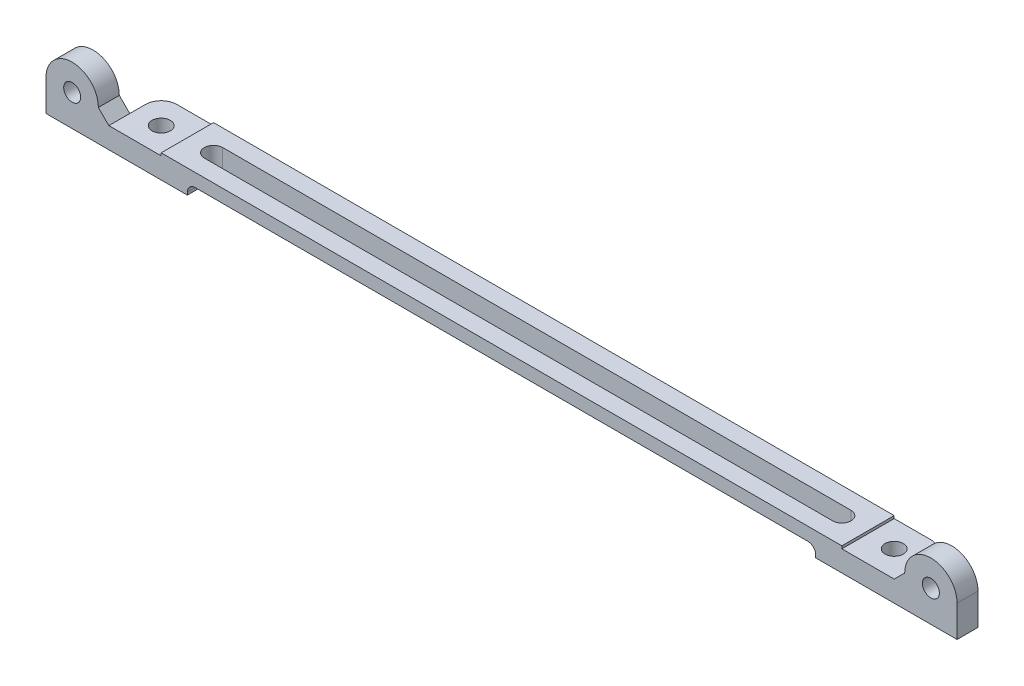
from build123d import *

# Parameters (mm, degrees)
SKETCH1_R           = 1.75
BOSS_EXTRUDE1_DEPTH = 4
SKETCH2_W           = 130
SKETCH2_H           = 10
BOSS_EXTRUDE2_DEPTH = 0.5
CUT_EXTRUDE1_DEPTH  = 2
SKETCH4_R           = 1.624205192
BOSS_EXTRUDE3_DEPTH = 4


with BuildPart() as part:
    # Sketch1 → Boss-Extrude1 (new body)
    with BuildSketch(Plane(origin=(0, 0, 0), x_dir=(1, 0, 0), z_dir=(0, 1, 0))):
        with BuildLine():
            ThreePointArc((75, 2), (74.121320344, 4.121320344), (72, 5))
            Line((72, 5), (-72, 5))
            ThreePointArc((-72, 5), (-74.121320344, 4.121320344), (-75, 2))
            Line((-75, 2), (-75, -5))
            Line((-75, -5), (75, -5))
            Line((75, -5), (75, 2))
        make_face()
        with Locations((-70, 0)):
            Circle(SKETCH1_R, mode=Mode.SUBTRACT)
        with BuildLine():
            ThreePointArc((61.75, 0), (61.237436867, -1.237436867), (60, -1.75))
            Line((60, -1.75), (-60, -1.75))
            ThreePointArc((-60, -1.75), (-61.75, 0), (-60, 1.75))
            Line((-60, 1.75), (60, 1.75))
            ThreePointArc((60, 1.75), (61.237436867, 1.237436867), (61.75, 0))
        make_face(mode=Mode.SUBTRACT)
        with Locations((70, 0)):
            Circle(SKETCH1_R, mode=Mode.SUBTRACT)
    extrude(amount=BOSS_EXTRUDE1_DEPTH)

    # Sketch2 → Boss-Extrude2 (add)
    with BuildSketch(Plane(origin=(0, 4, 0), x_dir=(1, 0, 0), z_dir=(0, 1, 0))):
        Rectangle(SKETCH2_W, SKETCH2_H)
        with BuildLine():
            Line((-60, 1.75), (60, 1.75))
            ThreePointArc((60, 1.75), (61.75, 0), (60, -1.75))
            Line((60, -1.75), (-60, -1.75))
            ThreePointArc((-60, -1.75), (-61.75, 0), (-60, 1.75))
        make_face(mode=Mode.SUBTRACT)
    extrude(amount=BOSS_EXTRUDE2_DEPTH)

    # Sketch3 → Cut-Extrude1 (cut)
    with BuildSketch(Plane.XY.offset(5)):
        with BuildLine():
            Line((-58.5, 2), (58.5, 2))
            ThreePointArc((58.5, 2), (59.560660172, 1.560660172), (60, 0.5))
            Line((60, 0.5), (60, 0))
            Line((60, 0), (-60, 0))
            Line((-60, 0), (-60, 0.5))
            ThreePointArc((-60, 0.5), (-59.560660172, 1.560660172), (-58.5, 2))
        make_face()
    extrude(amount=-CUT_EXTRUDE1_DEPTH, mode=Mode.SUBTRACT)

    # Sketch4 → Boss-Extrude3 (add)
    # profile 1 of 2: a face of its own
    with BuildSketch(Plane.XY.offset(5)):
        with BuildLine():
            Line((-87, 0), (-75, 0))
            Line((-75, 0), (-75, 4))
            Line((-75, 4), (-77, 6))
            ThreePointArc((-77, 6), (-82, 11), (-87, 6))
            Line((-87, 6), (-87, 0))
        make_face()
        with Locations((-82, 6)):
            Circle(SKETCH4_R, mode=Mode.SUBTRACT)
    # profile 2 of 2: a face of its own
    with BuildSketch(Plane.XY.offset(5)):
        with BuildLine():
            Line((77, 6), (75, 4))
            Line((75, 4), (75, 0))
            Line((75, 0), (87, 0))
            Line((87, 0), (87, 6))
            ThreePointArc((87, 6), (82, 11), (77, 6))
        make_face()
        with Locations((82, 6)):
            Circle(SKETCH4_R, mode=Mode.SUBTRACT)
    extrude(amount=-BOSS_EXTRUDE3_DEPTH)


solid = part.part
